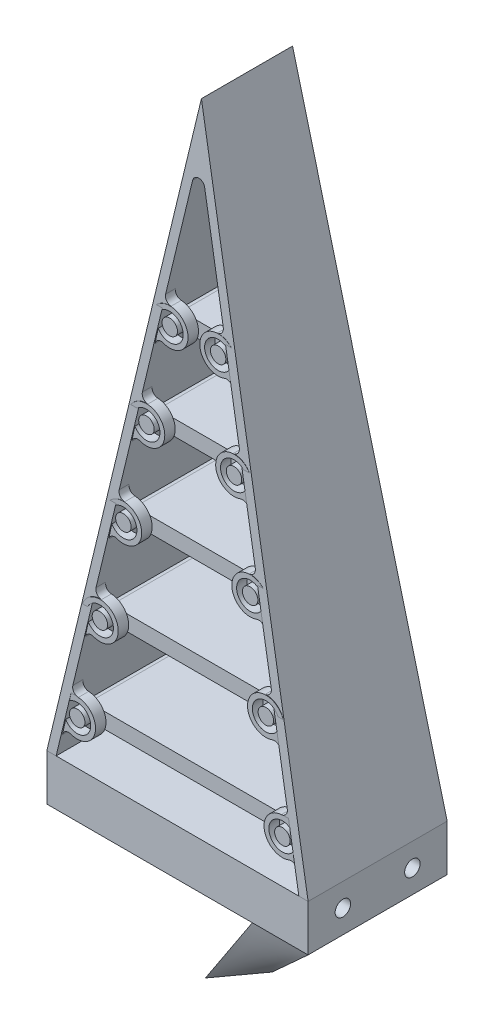
from build123d import *
from build123d.topology import SkipClean

# Parameters (mm, degrees)
AUFSATZ_LINEAR_AUSTRAGEN4_DEPTH      = 18
SCHNITT_LINEAR_AUSTRAGEN1_DEPTH      = 89.73537072
AUFSATZ_LINEAR_AUSTRAGEN5_DEPTH      = 5.37
AUFSATZ_LINEAR_AUSTRAGEN5_DEPTH_BACK = 5.37
AUFSATZ_LINEAR_AUSTRAGEN6_DEPTH      = 5.85
AUFSATZ_LINEAR_AUSTRAGEN6_DEPTH_BACK = 5.85
AUFSATZ_LINEAR_AUSTRAGEN7_DEPTH      = 6.3
AUFSATZ_LINEAR_AUSTRAGEN7_DEPTH_BACK = 6.3
AUFSATZ_LINEAR_AUSTRAGEN8_DEPTH      = 6.8
AUFSATZ_LINEAR_AUSTRAGEN8_DEPTH_BACK = 6.8
AUFSATZ_LINEAR_AUSTRAGEN9_DEPTH      = 7.2
AUFSATZ_LINEAR_AUSTRAGEN9_DEPTH_BACK = 7.2
SKIZZE13_R                           = 1
AUFSATZ_LINEAR_AUSTRAGEN12_DEPTH     = 1.5
SKIZZE15_R                           = 1
AUFSATZ_LINEAR_AUSTRAGEN14_DEPTH     = 1.5
SKIZZE14_R                           = 1
AUFSATZ_LINEAR_AUSTRAGEN13_DEPTH     = 1.5
SKIZZE16_R                           = 1
AUFSATZ_LINEAR_AUSTRAGEN15_DEPTH     = 1.5
SKIZZE17_R                           = 1
AUFSATZ_LINEAR_AUSTRAGEN16_DEPTH     = 1.5
SKIZZE18_R                           = 1
AUFSATZ_LINEAR_AUSTRAGEN17_DEPTH     = 1.5
SKIZZE19_R                           = 1
AUFSATZ_LINEAR_AUSTRAGEN18_DEPTH     = 1.5
SKIZZE20_R                           = 1
AUFSATZ_LINEAR_AUSTRAGEN19_DEPTH     = 1.5
SKIZZE21_R                           = 1
AUFSATZ_LINEAR_AUSTRAGEN20_DEPTH     = 1.5
SKIZZE22_R                           = 1
AUFSATZ_LINEAR_AUSTRAGEN21_DEPTH     = 1.5
SKIZZE24_R                           = 2.375
SKIZZE24_R_2                         = 1.75
AUFSATZ_LINEAR_AUSTRAGEN22_DEPTH     = 1.35
SKIZZE25_R                           = 2.375
SKIZZE25_R_2                         = 1.75
AUFSATZ_LINEAR_AUSTRAGEN23_DEPTH     = 1.35
SKIZZE26_R                           = 2.375
SKIZZE26_R_2                         = 1.75
AUFSATZ_LINEAR_AUSTRAGEN24_DEPTH     = 1.35
SKIZZE27_R                           = 2.375
SKIZZE27_R_2                         = 1.75
AUFSATZ_LINEAR_AUSTRAGEN25_DEPTH     = 1.35
SKIZZE28_R                           = 2.375
SKIZZE28_R_2                         = 1.75
AUFSATZ_LINEAR_AUSTRAGEN26_DEPTH     = 1.35
AUFSATZ_LINEAR_START                 = -1.35
SKIZZE29_R                           = 2.375
SKIZZE29_R_2                         = 1.75
AUFSATZ_LINEAR_AUSTRAGEN27_DEPTH     = 1.35
SKIZZE30_R                           = 2.375
SKIZZE30_R_2                         = 1.75
AUFSATZ_LINEAR_AUSTRAGEN28_DEPTH     = 1.35
SKIZZE31_R                           = 2.375
SKIZZE31_R_2                         = 1.75
AUFSATZ_LINEAR_AUSTRAGEN29_DEPTH     = 1.35
SKIZZE32_R                           = 2.375
SKIZZE32_R_2                         = 1.75
AUFSATZ_LINEAR_AUSTRAGEN30_DEPTH     = 1.35
SKIZZE33_R                           = 2.375
SKIZZE33_R_2                         = 1.75
AUFSATZ_LINEAR_AUSTRAGEN31_DEPTH     = 1.35
VERRUNDUNG1_R                        = 0.8
VERRUNDUNG2_R                        = 0.8
AUFSATZ_LINEAR_AUSTRAGEN32_DEPTH     = 6
SKIZZE78_R                           = 0.5
SCHNITT_LINEAR_AUSTRAGEN6_DEPTH      = 6
SKIZZE83_R                           = 1
SCHNITT_LINEAR_AUSTRAGEN7_DEPTH      = 4
SKIZZE84_R                           = 2
SCHNITT_LINEAR_AUSTRAGEN8_DEPTH      = 32
SKIZZE86_R                           = 1
SCHNITT_LINEAR_AUSTRAGEN9_DEPTH      = 4


with BuildPart() as part:
    # Skizze1 → Aufsatz-Linear austragen4 (new body)
    with BuildSketch(Plane.XY):
        Polygon((0, 0), (16.911148858, -80), (15.711148858, -80), (0, -5.676728459), (-15.711148858, -80), (-16.911148858, -80), align=None)
    extrude(amount=AUFSATZ_LINEAR_AUSTRAGEN4_DEPTH)

    # Skizze11 → Schnitt-Linear austragen1 (cut, through all)
    with BuildSketch(Plane(origin=(17, 0, 0), x_dir=(0, 0, -1), z_dir=(1, 0, 0))):
        Polygon((-18, -80), (-14.9, 0), (-18, 0), align=None)
        Polygon((0, -80), (-3.1, 0), (0, 0), align=None)
    extrude(amount=-SCHNITT_LINEAR_AUSTRAGEN1_DEPTH, mode=Mode.SUBTRACT)

    # Skizze24 → Aufsatz-Linear austragen22 (add)
    # profile 1 of 2: a face of its own
    with BuildSketch(Plane.XY.offset(15.87)):
        with Locations((-3.132547008, -26.676728459)):
            Circle(SKIZZE24_R)
        with Locations((-3.132547008, -26.676728459)):
            Circle(SKIZZE24_R_2, mode=Mode.SUBTRACT)
    # profile 2 of 2: a face of its own
    with BuildSketch(Plane.XY.offset(15.87)):
        with Locations((3.132547008, -26.676728459)):
            Circle(SKIZZE24_R)
        with Locations((3.132547008, -26.676728459)):
            Circle(SKIZZE24_R_2, mode=Mode.SUBTRACT)
    extrude(amount=-AUFSATZ_LINEAR_AUSTRAGEN22_DEPTH)

    # Skizze25 → Aufsatz-Linear austragen23 (add)
    # profile 1 of 2: a face of its own
    with BuildSketch(Plane.XY.offset(16.35)):
        with Locations((-5.669219336, -38.676728459)):
            Circle(SKIZZE25_R)
        with Locations((-5.669219336, -38.676728459)):
            Circle(SKIZZE25_R_2, mode=Mode.SUBTRACT)
    # profile 2 of 2: a face of its own
    with BuildSketch(Plane.XY.offset(16.35)):
        with Locations((5.669219336, -38.676728459)):
            Circle(SKIZZE25_R)
        with Locations((5.669219336, -38.676728459)):
            Circle(SKIZZE25_R_2, mode=Mode.SUBTRACT)
    extrude(amount=-AUFSATZ_LINEAR_AUSTRAGEN23_DEPTH)

    # Skizze26 → Aufsatz-Linear austragen24 (add)
    # profile 1 of 2: a face of its own
    with BuildSketch(Plane.XY.offset(16.8)):
        with Locations((-8.205891665, -50.676728459)):
            Circle(SKIZZE26_R)
        with Locations((-8.205891665, -50.676728459)):
            Circle(SKIZZE26_R_2, mode=Mode.SUBTRACT)
    # profile 2 of 2: a face of its own
    with BuildSketch(Plane.XY.offset(16.8)):
        with Locations((8.205891665, -50.676728459)):
            Circle(SKIZZE26_R)
        with Locations((8.205891665, -50.676728459)):
            Circle(SKIZZE26_R_2, mode=Mode.SUBTRACT)
    extrude(amount=-AUFSATZ_LINEAR_AUSTRAGEN24_DEPTH)

    # Skizze27 → Aufsatz-Linear austragen25 (add)
    # profile 1 of 2: a face of its own
    with BuildSketch(Plane.XY.offset(17.3)):
        with Locations((-10.742563994, -62.676728459)):
            Circle(SKIZZE27_R)
        with Locations((-10.742563994, -62.676728459)):
            Circle(SKIZZE27_R_2, mode=Mode.SUBTRACT)
    # profile 2 of 2: a face of its own
    with BuildSketch(Plane.XY.offset(17.3)):
        with Locations((10.742563994, -62.676728459)):
            Circle(SKIZZE27_R)
        with Locations((10.742563994, -62.676728459)):
            Circle(SKIZZE27_R_2, mode=Mode.SUBTRACT)
    extrude(amount=-AUFSATZ_LINEAR_AUSTRAGEN25_DEPTH)

    # Skizze28 → Aufsatz-Linear austragen26 (add)
    # profile 1 of 2: a face of its own
    with BuildSketch(Plane.XY.offset(17.7)):
        with Locations((-13.279236322, -74.676728459)):
            Circle(SKIZZE28_R)
        with Locations((-13.279236322, -74.676728459)):
            Circle(SKIZZE28_R_2, mode=Mode.SUBTRACT)
    # profile 2 of 2: a face of its own
    with BuildSketch(Plane.XY.offset(17.7)):
        with Locations((13.279236322, -74.676728459)):
            Circle(SKIZZE28_R)
        with Locations((13.279236322, -74.676728459)):
            Circle(SKIZZE28_R_2, mode=Mode.SUBTRACT)
    extrude(amount=-AUFSATZ_LINEAR_AUSTRAGEN26_DEPTH)

    # Skizze29 → Aufsatz-Linear austragen27 (add)
    # profile 1 of 2: a face of its own
    with BuildSketch(Plane(origin=(0, 0, 2.13), x_dir=(-1, 0, 0), z_dir=(0, 0, -1)).offset(AUFSATZ_LINEAR_START)):
        with Locations((-3.132547008, -26.676728459)):
            Circle(SKIZZE29_R)
        with Locations((-3.132547008, -26.676728459)):
            Circle(SKIZZE29_R_2, mode=Mode.SUBTRACT)
    # profile 2 of 2: a face of its own
    with BuildSketch(Plane(origin=(0, 0, 2.13), x_dir=(-1, 0, 0), z_dir=(0, 0, -1)).offset(AUFSATZ_LINEAR_START)):
        with Locations((3.132547008, -26.676728459)):
            Circle(SKIZZE29_R)
        with Locations((3.132547008, -26.676728459)):
            Circle(SKIZZE29_R_2, mode=Mode.SUBTRACT)
    extrude(amount=AUFSATZ_LINEAR_AUSTRAGEN27_DEPTH)

    # Skizze30 → Aufsatz-Linear austragen28 (add)
    # profile 1 of 2: a face of its own
    with BuildSketch(Plane(origin=(0, 0, 1.65), x_dir=(-1, 0, 0), z_dir=(0, 0, -1)).offset(AUFSATZ_LINEAR_START)):
        with Locations((-5.669219336, -38.676728459)):
            Circle(SKIZZE30_R)
        with Locations((-5.669219336, -38.676728459)):
            Circle(SKIZZE30_R_2, mode=Mode.SUBTRACT)
    # profile 2 of 2: a face of its own
    with BuildSketch(Plane(origin=(0, 0, 1.65), x_dir=(-1, 0, 0), z_dir=(0, 0, -1)).offset(AUFSATZ_LINEAR_START)):
        with Locations((5.669219336, -38.676728459)):
            Circle(SKIZZE30_R)
        with Locations((5.669219336, -38.676728459)):
            Circle(SKIZZE30_R_2, mode=Mode.SUBTRACT)
    extrude(amount=AUFSATZ_LINEAR_AUSTRAGEN28_DEPTH)

    # Skizze31 → Aufsatz-Linear austragen29 (add)
    # profile 1 of 2: a face of its own
    with BuildSketch(Plane(origin=(0, 0, 1.2), x_dir=(-1, 0, 0), z_dir=(0, 0, -1)).offset(AUFSATZ_LINEAR_START)):
        with Locations((-8.205891665, -50.676728459)):
            Circle(SKIZZE31_R)
        with Locations((-8.205891665, -50.676728459)):
            Circle(SKIZZE31_R_2, mode=Mode.SUBTRACT)
    # profile 2 of 2: a face of its own
    with BuildSketch(Plane(origin=(0, 0, 1.2), x_dir=(-1, 0, 0), z_dir=(0, 0, -1)).offset(AUFSATZ_LINEAR_START)):
        with Locations((8.205891665, -50.676728459)):
            Circle(SKIZZE31_R)
        with Locations((8.205891665, -50.676728459)):
            Circle(SKIZZE31_R_2, mode=Mode.SUBTRACT)
    extrude(amount=AUFSATZ_LINEAR_AUSTRAGEN29_DEPTH)

    # Skizze32 → Aufsatz-Linear austragen30 (add)
    # profile 1 of 2: a face of its own
    with BuildSketch(Plane(origin=(0, 0, 0.7), x_dir=(-1, 0, 0), z_dir=(0, 0, -1)).offset(AUFSATZ_LINEAR_START)):
        with Locations((-10.742563994, -62.676728459)):
            Circle(SKIZZE32_R)
        with Locations((-10.742563994, -62.676728459)):
            Circle(SKIZZE32_R_2, mode=Mode.SUBTRACT)
    # profile 2 of 2: a face of its own
    with BuildSketch(Plane(origin=(0, 0, 0.7), x_dir=(-1, 0, 0), z_dir=(0, 0, -1)).offset(AUFSATZ_LINEAR_START)):
        with Locations((10.742563994, -62.676728459)):
            Circle(SKIZZE32_R)
        with Locations((10.742563994, -62.676728459)):
            Circle(SKIZZE32_R_2, mode=Mode.SUBTRACT)
    extrude(amount=AUFSATZ_LINEAR_AUSTRAGEN30_DEPTH)

    # Skizze33 → Aufsatz-Linear austragen31 (add)
    # profile 1 of 2: a face of its own
    with BuildSketch(Plane(origin=(0, 0, 0.3), x_dir=(-1, 0, 0), z_dir=(0, 0, -1)).offset(AUFSATZ_LINEAR_START)):
        with Locations((-13.279236322, -74.676728459)):
            Circle(SKIZZE33_R)
        with Locations((-13.279236322, -74.676728459)):
            Circle(SKIZZE33_R_2, mode=Mode.SUBTRACT)
    # profile 2 of 2: a face of its own
    with BuildSketch(Plane(origin=(0, 0, 0.3), x_dir=(-1, 0, 0), z_dir=(0, 0, -1)).offset(AUFSATZ_LINEAR_START)):
        with Locations((13.279236322, -74.676728459)):
            Circle(SKIZZE33_R)
        with Locations((13.279236322, -74.676728459)):
            Circle(SKIZZE33_R_2, mode=Mode.SUBTRACT)
    extrude(amount=AUFSATZ_LINEAR_AUSTRAGEN31_DEPTH)

    # Verrundung1
    verrundung1_edges = [part.edges().sort_by_distance(p)[0] for p in [
        (0, -5.676728459, 9),
    ]]
    fillet(verrundung1_edges, radius=VERRUNDUNG1_R)

    # Verrundung2
    # the kernel refuses this fillet: 0.8 mm, written as the material it adds along each edge
    with BuildSketch(Plane(origin=(7.333926251, -40.370651683, 15), x_dir=(0.20681895998091462, -0.9783792300495819, 0), z_dir=(0, 0, 1)), Plane(origin=(9.87059858, -52.370651683, 15.45), x_dir=(0.20681895998091263, -0.9783792300495825, 0), z_dir=(0, 0, 1)), Plane(origin=(12.407270908, -64.370651683, 15.95), x_dir=(0.20681895998091412, -0.9783792300495822, 0), z_dir=(0, 0, 1)), Plane(origin=(14.943943237, -76.370651683, 16.35), x_dir=(0.20681895998090907, -0.9783792300495833, 0), z_dir=(0, 0, 1)), Plane(origin=(4.797253922, -28.370651683, 2.13), x_dir=(0.20681895998091462, -0.9783792300495819, 0), z_dir=(0, 0, 1)), Plane(origin=(7.333926251, -40.370651683, 1.65), x_dir=(0.20681895998091462, -0.9783792300495819, 0), z_dir=(0, 0, 1)), Plane(origin=(9.87059858, -52.370651683, 1.2), x_dir=(0.20681895998091412, -0.9783792300495822, 0), z_dir=(0, 0, 1)), Plane(origin=(12.407270908, -64.370651683, 0.7), x_dir=(0.20681895998091412, -0.9783792300495822, 0), z_dir=(0, 0, 1)), Plane(origin=(14.943943237, -76.370651683, 0.3), x_dir=(0.20681895998091113, -0.9783792300495827, 0), z_dir=(0, 0, 1)), Plane(origin=(4.797253922, -28.370651683, 14.52), x_dir=(0.20681895998091462, -0.9783792300495819, 0), z_dir=(0, 0, 1))) as verrundung2_piece_1:
        with BuildLine():
            CenterArc((1.137162009, -0.8), VERRUNDUNG2_R, 90, 98.665792169)
            ThreePointArc((0.346294794, -0.920536499), (0.221320117, -0.44214625), (0, 0))
            Line((0, 0), (1.137162009, 0))
        make_face()
    extrude(amount=1.35)
    with BuildSketch(Plane(origin=(6.505991795, -36.45401911, 15), x_dir=(-0.20681895998091487, 0.9783792300495819, 0), z_dir=(0, 0, 1))) as verrundung2_piece_2_section:
        with BuildLine():
            CenterArc((1.137162009, 0.8), VERRUNDUNG2_R, 171.334207831, 98.665792169)
            ThreePointArc((0.346294794, 0.920536499), (0.221320117, 0.44214625), (0, 0))
            Line((0, 0), (1.137162009, 0))
        make_face()
    verrundung2_piece_2 = extrude(amount=4.155498263, mode=Mode.PRIVATE)
    verrundung2_piece_2 = split(verrundung2_piece_2, bisect_by=Plane(origin=(6.217215771, -36.095589606, 16.298704097), z_dir=(0, -0.03872093994908253, -0.9992500632021294)), keep=Keep.TOP, mode=Mode.PRIVATE)
    add(verrundung2_piece_2)
    with BuildSketch(Plane(origin=(-9.87059858, -52.370651683, 15.45), x_dir=(-0.20681895998091412, -0.9783792300495822, 0), z_dir=(0, 0, 1)), Plane(origin=(-12.407270908, -64.370651683, 15.95), x_dir=(-0.2068189599809156, -0.9783792300495817, 0), z_dir=(0, 0, 1)), Plane(origin=(-14.943943237, -76.370651683, 16.35), x_dir=(-0.2068189599809131, -0.9783792300495824, 0), z_dir=(0, 0, 1)), Plane(origin=(-4.797253922, -28.370651683, 2.13), x_dir=(-0.20681895998091113, -0.9783792300495827, 0), z_dir=(0, 0, 1)), Plane(origin=(-7.333926251, -40.370651683, 1.65), x_dir=(-0.2068189599809139, -0.9783792300495822, 0), z_dir=(0, 0, 1)), Plane(origin=(-9.87059858, -52.370651683, 1.2), x_dir=(-0.20681895998091412, -0.9783792300495822, 0), z_dir=(0, 0, 1)), Plane(origin=(-12.407270908, -64.370651683, 0.7), x_dir=(-0.20681895998091412, -0.9783792300495822, 0), z_dir=(0, 0, 1)), Plane(origin=(-14.943943237, -76.370651683, 0.3), x_dir=(-0.2068189599809131, -0.9783792300495824, 0), z_dir=(0, 0, 1)), Plane(origin=(-4.797253922, -28.370651683, 14.52), x_dir=(-0.20681895998091177, -0.9783792300495826, 0), z_dir=(0, 0, 1)), Plane(origin=(-7.333926251, -40.370651683, 15), x_dir=(-0.20681895998091412, -0.9783792300495822, 0), z_dir=(0, 0, 1))) as verrundung2_piece_3:
        with BuildLine():
            CenterArc((1.137162009, 0.8), VERRUNDUNG2_R, 171.334207831, 98.665792169)
            ThreePointArc((0.346294794, 0.920536499), (0.221320117, 0.44214625), (0, 0))
            Line((0, 0), (1.137162009, 0))
        make_face()
    extrude(amount=1.35)
    with BuildSketch(Plane(origin=(-9.042664124, -48.45401911, 15.45), x_dir=(0.20681895998091288, 0.9783792300495825, 0), z_dir=(0, 0, 1))) as verrundung2_piece_4_section:
        with BuildLine():
            CenterArc((1.137162009, -0.8), VERRUNDUNG2_R, 90, 98.665792169)
            ThreePointArc((0.346294794, -0.920536499), (0.221320117, -0.44214625), (0, 0))
            Line((0, 0), (1.137162009, 0))
        make_face()
    verrundung2_piece_4 = extrude(amount=4.170498263, mode=Mode.PRIVATE)
    verrundung2_piece_4 = split(verrundung2_piece_4, bisect_by=Plane(origin=(-8.753891259, -48.095283689, 16.763692243), z_dir=(0, -0.03872093994908253, -0.9992500632021294)), keep=Keep.TOP, mode=Mode.PRIVATE)
    add(verrundung2_piece_4)
    with BuildSketch(Plane(origin=(9.042664124, -48.45401911, 15.45), x_dir=(-0.2068189599809156, 0.9783792300495817, 0), z_dir=(0, 0, 1))) as verrundung2_piece_5_section:
        with BuildLine():
            CenterArc((1.137162009, 0.8), VERRUNDUNG2_R, 171.334207831, 98.665792169)
            ThreePointArc((0.346294794, 0.920536499), (0.221320117, 0.44214625), (0, 0))
            Line((0, 0), (1.137162009, 0))
        make_face()
    verrundung2_piece_5 = extrude(amount=4.170498263, mode=Mode.PRIVATE)
    verrundung2_piece_5 = split(verrundung2_piece_5, bisect_by=Plane(origin=(8.753891259, -48.095283689, 16.763692243), z_dir=(0, -0.03872093994908253, -0.9992500632021294)), keep=Keep.TOP, mode=Mode.PRIVATE)
    add(verrundung2_piece_5)
    with BuildSketch(Plane(origin=(-11.579336453, -60.45401911, 15.95), x_dir=(0.2068189599809101, 0.9783792300495829, 0), z_dir=(0, 0, 1))) as verrundung2_piece_6_section:
        with BuildLine():
            CenterArc((1.137162009, -0.8), VERRUNDUNG2_R, 90, 98.665792169)
            ThreePointArc((0.346294794, -0.920536499), (0.221320117, -0.44214625), (0, 0))
            Line((0, 0), (1.137162009, 0))
        make_face()
    verrundung2_piece_6 = extrude(amount=4.135498263, mode=Mode.PRIVATE)
    verrundung2_piece_6 = split(verrundung2_piece_6, bisect_by=Plane(origin=(-11.290556099, -60.095998069, 17.228719925), z_dir=(0, -0.03872093994908253, -0.9992500632021294)), keep=Keep.TOP, mode=Mode.PRIVATE)
    add(verrundung2_piece_6)
    with BuildSketch(Plane(origin=(11.579336453, -60.45401911, 15.95), x_dir=(-0.20681895998091435, 0.978379230049582, 0), z_dir=(0, 0, 1))) as verrundung2_piece_7_section:
        with BuildLine():
            CenterArc((1.137162009, 0.8), VERRUNDUNG2_R, 171.334207831, 98.665792169)
            ThreePointArc((0.346294794, 0.920536499), (0.221320117, 0.44214625), (0, 0))
            Line((0, 0), (1.137162009, 0))
        make_face()
    verrundung2_piece_7 = extrude(amount=4.135498263, mode=Mode.PRIVATE)
    verrundung2_piece_7 = split(verrundung2_piece_7, bisect_by=Plane(origin=(11.290556099, -60.095998069, 17.228719925), z_dir=(0, -0.03872093994908253, -0.9992500632021294)), keep=Keep.TOP, mode=Mode.PRIVATE)
    add(verrundung2_piece_7)
    with BuildSketch(Plane(origin=(-14.116008781, -72.45401911, 16.35), x_dir=(0.20681895998091412, 0.9783792300495822, 0), z_dir=(0, 0, 1))) as verrundung2_piece_8_section:
        with BuildLine():
            CenterArc((1.137162009, -0.8), VERRUNDUNG2_R, 90, 98.665792169)
            ThreePointArc((0.346294794, -0.920536499), (0.221320117, -0.44214625), (0, 0))
            Line((0, 0), (1.137162009, 0))
        make_face()
    verrundung2_piece_8 = extrude(amount=1.35, mode=Mode.PRIVATE)
    verrundung2_piece_8 = split(verrundung2_piece_8, bisect_by=Plane(origin=(-13.827218085, -72.094512866, 17.693662374), z_dir=(0, -0.03872093994908253, -0.9992500632021294)), keep=Keep.TOP, mode=Mode.PRIVATE)
    add(verrundung2_piece_8)
    with BuildSketch(Plane(origin=(14.116008781, -72.45401911, 16.35), x_dir=(-0.20681895998091662, 0.9783792300495815, 0), z_dir=(0, 0, 1))) as verrundung2_piece_9_section:
        with BuildLine():
            CenterArc((1.137162009, 0.8), VERRUNDUNG2_R, 171.334207831, 98.665792169)
            ThreePointArc((0.346294794, 0.920536499), (0.221320117, 0.44214625), (0, 0))
            Line((0, 0), (1.137162009, 0))
        make_face()
    verrundung2_piece_9 = extrude(amount=1.35, mode=Mode.PRIVATE)
    verrundung2_piece_9 = split(verrundung2_piece_9, bisect_by=Plane(origin=(13.827218085, -72.094512866, 17.693662374), z_dir=(0, -0.03872093994908253, -0.9992500632021294)), keep=Keep.TOP, mode=Mode.PRIVATE)
    add(verrundung2_piece_9)
    with BuildSketch(Plane(origin=(3.969319467, -24.45401911, -0.690498263), x_dir=(-0.20681895998091412, 0.9783792300495822, 0), z_dir=(0, 0, 1))) as verrundung2_piece_10_section:
        with BuildLine():
            CenterArc((1.137162009, 0.8), VERRUNDUNG2_R, 171.334207831, 98.665792169)
            ThreePointArc((0.346294794, 0.920536499), (0.221320117, 0.44214625), (0, 0))
            Line((0, 0), (1.137162009, 0))
        make_face()
    verrundung2_piece_10 = extrude(amount=4.170498263, mode=Mode.PRIVATE)
    verrundung2_piece_10 = split(verrundung2_piece_10, bisect_by=Plane(origin=(3.680546602, -24.095283689, 2.166307757), z_dir=(0, -0.03872093994908251, 0.9992500632021294)), keep=Keep.TOP, mode=Mode.PRIVATE)
    add(verrundung2_piece_10)
    with BuildSketch(Plane(origin=(-3.969319467, -24.45401911, -0.690498263), x_dir=(0.20681895998091285, 0.9783792300495823, 0), z_dir=(0, 0, 1))) as verrundung2_piece_11_section:
        with BuildLine():
            CenterArc((1.137162009, -0.8), VERRUNDUNG2_R, 90, 98.665792169)
            ThreePointArc((0.346294794, -0.920536499), (0.221320117, -0.44214625), (0, 0))
            Line((0, 0), (1.137162009, 0))
        make_face()
    verrundung2_piece_11 = extrude(amount=4.170498263, mode=Mode.PRIVATE)
    verrundung2_piece_11 = split(verrundung2_piece_11, bisect_by=Plane(origin=(-3.680546602, -24.095283689, 2.166307757), z_dir=(0, -0.03872093994908251, 0.9992500632021294)), keep=Keep.TOP, mode=Mode.PRIVATE)
    add(verrundung2_piece_11)
    with BuildSketch(Plane(origin=(6.505991795, -36.45401911, -1.155498263), x_dir=(-0.20681895998091537, 0.9783792300495818, 0), z_dir=(0, 0, 1))) as verrundung2_piece_12_section:
        with BuildLine():
            CenterArc((1.137162009, 0.8), VERRUNDUNG2_R, 171.334207831, 98.665792169)
            ThreePointArc((0.346294794, 0.920536499), (0.221320117, 0.44214625), (0, 0))
            Line((0, 0), (1.137162009, 0))
        make_face()
    verrundung2_piece_12 = extrude(amount=4.155498263, mode=Mode.PRIVATE)
    verrundung2_piece_12 = split(verrundung2_piece_12, bisect_by=Plane(origin=(6.217215771, -36.095589606, 1.701295903), z_dir=(0, -0.03872093994908251, 0.9992500632021294)), keep=Keep.TOP, mode=Mode.PRIVATE)
    add(verrundung2_piece_12)
    with BuildSketch(Plane(origin=(-6.505991795, -36.45401911, -1.155498263), x_dir=(0.20681895998091288, 0.9783792300495825, 0), z_dir=(0, 0, 1))) as verrundung2_piece_13_section:
        with BuildLine():
            CenterArc((1.137162009, -0.8), VERRUNDUNG2_R, 90, 98.665792169)
            ThreePointArc((0.346294794, -0.920536499), (0.221320117, -0.44214625), (0, 0))
            Line((0, 0), (1.137162009, 0))
        make_face()
    verrundung2_piece_13 = extrude(amount=4.155498263, mode=Mode.PRIVATE)
    verrundung2_piece_13 = split(verrundung2_piece_13, bisect_by=Plane(origin=(-6.217215771, -36.095589606, 1.701295903), z_dir=(0, -0.03872093994908251, 0.9992500632021294)), keep=Keep.TOP, mode=Mode.PRIVATE)
    add(verrundung2_piece_13)
    with BuildSketch(Plane(origin=(9.042664124, -48.45401911, -1.620498263), x_dir=(-0.20681895998091412, 0.9783792300495822, 0), z_dir=(0, 0, 1))) as verrundung2_piece_14_section:
        with BuildLine():
            CenterArc((1.137162009, 0.8), VERRUNDUNG2_R, 171.334207831, 98.665792169)
            ThreePointArc((0.346294794, 0.920536499), (0.221320117, 0.44214625), (0, 0))
            Line((0, 0), (1.137162009, 0))
        make_face()
    verrundung2_piece_14 = extrude(amount=4.170498263, mode=Mode.PRIVATE)
    verrundung2_piece_14 = split(verrundung2_piece_14, bisect_by=Plane(origin=(8.753891259, -48.095283689, 1.236307757), z_dir=(0, -0.03872093994908251, 0.9992500632021294)), keep=Keep.TOP, mode=Mode.PRIVATE)
    add(verrundung2_piece_14)
    with BuildSketch(Plane(origin=(-9.042664124, -48.45401911, -1.620498263), x_dir=(0.20681895998091263, 0.9783792300495825, 0), z_dir=(0, 0, 1))) as verrundung2_piece_15_section:
        with BuildLine():
            CenterArc((1.137162009, -0.8), VERRUNDUNG2_R, 90, 98.665792169)
            ThreePointArc((0.346294794, -0.920536499), (0.221320117, -0.44214625), (0, 0))
            Line((0, 0), (1.137162009, 0))
        make_face()
    verrundung2_piece_15 = extrude(amount=4.170498263, mode=Mode.PRIVATE)
    verrundung2_piece_15 = split(verrundung2_piece_15, bisect_by=Plane(origin=(-8.753891259, -48.095283689, 1.236307757), z_dir=(0, -0.03872093994908251, 0.9992500632021294)), keep=Keep.TOP, mode=Mode.PRIVATE)
    add(verrundung2_piece_15)
    with BuildSketch(Plane(origin=(11.579336453, -60.45401911, -2.085498263), x_dir=(-0.20681895998091412, 0.9783792300495822, 0), z_dir=(0, 0, 1))) as verrundung2_piece_16_section:
        with BuildLine():
            CenterArc((1.137162009, 0.8), VERRUNDUNG2_R, 171.334207831, 98.665792169)
            ThreePointArc((0.346294794, 0.920536499), (0.221320117, 0.44214625), (0, 0))
            Line((0, 0), (1.137162009, 0))
        make_face()
    verrundung2_piece_16 = extrude(amount=4.135498263, mode=Mode.PRIVATE)
    verrundung2_piece_16 = split(verrundung2_piece_16, bisect_by=Plane(origin=(11.290556099, -60.095998069, 0.771280075), z_dir=(0, -0.03872093994908251, 0.9992500632021294)), keep=Keep.TOP, mode=Mode.PRIVATE)
    add(verrundung2_piece_16)
    with BuildSketch(Plane(origin=(-11.579336453, -60.45401911, -2.085498263), x_dir=(0.2068189599809131, 0.9783792300495824, 0), z_dir=(0, 0, 1))) as verrundung2_piece_17_section:
        with BuildLine():
            CenterArc((1.137162009, -0.8), VERRUNDUNG2_R, 90, 98.665792169)
            ThreePointArc((0.346294794, -0.920536499), (0.221320117, -0.44214625), (0, 0))
            Line((0, 0), (1.137162009, 0))
        make_face()
    verrundung2_piece_17 = extrude(amount=4.135498263, mode=Mode.PRIVATE)
    verrundung2_piece_17 = split(verrundung2_piece_17, bisect_by=Plane(origin=(-11.290556099, -60.095998069, 0.771280075), z_dir=(0, -0.03872093994908251, 0.9992500632021294)), keep=Keep.TOP, mode=Mode.PRIVATE)
    add(verrundung2_piece_17)
    with BuildSketch(Plane(origin=(14.116008781, -72.45401911, 0.3), x_dir=(-0.2068189599809156, 0.9783792300495817, 0), z_dir=(0, 0, 1))) as verrundung2_piece_18_section:
        with BuildLine():
            CenterArc((1.137162009, 0.8), VERRUNDUNG2_R, 171.334207831, 98.665792169)
            ThreePointArc((0.346294794, 0.920536499), (0.221320117, 0.44214625), (0, 0))
            Line((0, 0), (1.137162009, 0))
        make_face()
    verrundung2_piece_18 = extrude(amount=1.35, mode=Mode.PRIVATE)
    verrundung2_piece_18 = split(verrundung2_piece_18, bisect_by=Plane(origin=(13.827218085, -72.094512866, 0.306337626), z_dir=(0, -0.03872093994908251, 0.9992500632021294)), keep=Keep.TOP, mode=Mode.PRIVATE)
    add(verrundung2_piece_18)
    with BuildSketch(Plane(origin=(-14.116008781, -72.45401911, 0.3), x_dir=(0.20681895998091412, 0.9783792300495822, 0), z_dir=(0, 0, 1))) as verrundung2_piece_19_section:
        with BuildLine():
            CenterArc((1.137162009, -0.8), VERRUNDUNG2_R, 90, 98.665792169)
            ThreePointArc((0.346294794, -0.920536499), (0.221320117, -0.44214625), (0, 0))
            Line((0, 0), (1.137162009, 0))
        make_face()
    verrundung2_piece_19 = extrude(amount=1.35, mode=Mode.PRIVATE)
    verrundung2_piece_19 = split(verrundung2_piece_19, bisect_by=Plane(origin=(-13.827218085, -72.094512866, 0.306337626), z_dir=(0, -0.03872093994908251, 0.9992500632021294)), keep=Keep.TOP, mode=Mode.PRIVATE)
    add(verrundung2_piece_19)
    with BuildSketch(Plane(origin=(-3.969319467, -24.45401911, 14.52), x_dir=(0.20681895998091399, 0.978379230049582, 0), z_dir=(0, 0, 1))) as verrundung2_piece_20_section:
        with BuildLine():
            CenterArc((1.137162009, -0.8), VERRUNDUNG2_R, 90, 98.665792169)
            ThreePointArc((0.346294794, -0.920536499), (0.221320117, -0.44214625), (0, 0))
            Line((0, 0), (1.137162009, 0))
        make_face()
    verrundung2_piece_20 = extrude(amount=4.170498263, mode=Mode.PRIVATE)
    verrundung2_piece_20 = split(verrundung2_piece_20, bisect_by=Plane(origin=(-3.680546602, -24.095283689, 15.833692243), z_dir=(0, -0.03872093994908253, -0.9992500632021294)), keep=Keep.TOP, mode=Mode.PRIVATE)
    add(verrundung2_piece_20)
    with BuildSketch(Plane(origin=(3.969319467, -24.45401911, 14.52), x_dir=(-0.20681895998091487, 0.9783792300495819, 0), z_dir=(0, 0, 1))) as verrundung2_piece_21_section:
        with BuildLine():
            CenterArc((1.137162009, 0.8), VERRUNDUNG2_R, 171.334207831, 98.665792169)
            ThreePointArc((0.346294794, 0.920536499), (0.221320117, 0.44214625), (0, 0))
            Line((0, 0), (1.137162009, 0))
        make_face()
    verrundung2_piece_21 = extrude(amount=4.170498263, mode=Mode.PRIVATE)
    verrundung2_piece_21 = split(verrundung2_piece_21, bisect_by=Plane(origin=(3.680546602, -24.095283689, 15.833692243), z_dir=(0, -0.03872093994908253, -0.9992500632021294)), keep=Keep.TOP, mode=Mode.PRIVATE)
    add(verrundung2_piece_21)
    with BuildSketch(Plane(origin=(-6.505991795, -36.45401911, 15), x_dir=(0.20681895998091263, 0.9783792300495825, 0), z_dir=(0, 0, 1))) as verrundung2_piece_22_section:
        with BuildLine():
            CenterArc((1.137162009, -0.8), VERRUNDUNG2_R, 90, 98.665792169)
            ThreePointArc((0.346294794, -0.920536499), (0.221320117, -0.44214625), (0, 0))
            Line((0, 0), (1.137162009, 0))
        make_face()
    verrundung2_piece_22 = extrude(amount=4.155498263, mode=Mode.PRIVATE)
    verrundung2_piece_22 = split(verrundung2_piece_22, bisect_by=Plane(origin=(-6.217215771, -36.095589606, 16.298704097), z_dir=(0, -0.03872093994908253, -0.9992500632021294)), keep=Keep.TOP, mode=Mode.PRIVATE)
    add(verrundung2_piece_22)

    # Skizze37 → Aufsatz-Linear austragen32 (add)
    with BuildSketch(Plane.XZ.offset(80)):
        Polygon((-16.911148858, 0), (-15.711148858, 0), (16.911148858, 0), (16.911148858, 18), (-16.911148858, 18), align=None)
    extrude(amount=AUFSATZ_LINEAR_AUSTRAGEN32_DEPTH)

    # Skizze68 → Ausformung1 section 0
    with BuildSketch(Plane.XZ.offset(86)):
        with BuildLine():
            Line((16.911148858, 0), (16.911148858, 18))
            Line((16.911148858, 18), (9.693720963, 18))
            Line((9.693720963, 18), (9.693720963, 0))
            Line((9.693720963, 0), (16.911148858, 0))
        make_face()
    # Skizze80 → Ausformung1 section 1
    with BuildSketch(Plane(origin=(42.871879577, -74.256273644, 0), x_dir=(0, 0, -1), z_dir=(0.500000000000001, -0.866025403784438, 0))):
        with BuildLine():
            Line((-3.999971038, -49.932917644), (-3.999971038, -39.951059688))
            Line((-3.999971038, -39.951059688), (-14.009034932, -39.951059688))
            Line((-14.009034932, -39.951059688), (-14.009034932, -49.932917644))
            Line((-14.009034932, -49.932917644), (-3.999971038, -49.932917644))
        make_face()
    loft()

    # Skizze78 → Schnitt-Linear austragen6 (cut)
    with BuildSketch(Plane.XZ.offset(86)):
        with Locations(Location((-13.614380811, 9, 0), (0, 0, 270))):
            Circle(SKIZZE78_R)
    extrude(amount=-SCHNITT_LINEAR_AUSTRAGEN6_DEPTH, mode=Mode.SUBTRACT)

    # Skizze83 → Schnitt-Linear austragen7 (cut)
    with BuildSketch(Plane(origin=(42.871879577, -74.256273644, 0), x_dir=(0.8660254037844386, 0.5000000000000002, 0), z_dir=(0.5000000000000001, -0.8660254037844385, 0))):
        with Locations((-44.941988666, 9.004502985)):
            Circle(SKIZZE83_R)
    extrude(amount=-SCHNITT_LINEAR_AUSTRAGEN7_DEPTH, mode=Mode.SUBTRACT)

    # Skizze84 → Schnitt-Linear austragen8 (cut)
    with BuildSketch(Plane.ZY.offset(16.911148858)):
        with Locations((13.5, -83)):
            Circle(SKIZZE84_R)
        with Locations((4.5, -83)):
            Circle(SKIZZE84_R)
    extrude(amount=-SCHNITT_LINEAR_AUSTRAGEN8_DEPTH, mode=Mode.SUBTRACT)

    # Skizze86 → Schnitt-Linear austragen9 (cut)
    with BuildSketch(Plane(origin=(16.911148858, 0, 0), x_dir=(0, 0, -1), z_dir=(1, 0, 0))):
        with Locations((-13.5, -83)):
            Circle(SKIZZE86_R)
        with Locations((-4.5, -83)):
            Circle(SKIZZE86_R)
    extrude(amount=-SCHNITT_LINEAR_AUSTRAGEN9_DEPTH, mode=Mode.SUBTRACT)


with BuildPart() as body_2:
    # Skizze6 → Aufsatz-Linear austragen5 (new, two sides: drawn at the far end of the back side and taken through both)
    with BuildSketch(Plane.XY.offset(9).offset(-AUFSATZ_LINEAR_AUSTRAGEN5_DEPTH_BACK)):
        with BuildLine():
            Line((3.132547008, -25.676728459), (-3.132547008, -25.676728459))
            ThreePointArc((-3.132547008, -25.676728459), (-4.132547008, -26.676728459), (-3.132547008, -27.676728459))
            Line((-3.132547008, -27.676728459), (3.132547008, -27.676728459))
            ThreePointArc((3.132547008, -27.676728459), (4.132547008, -26.676728459), (3.132547008, -25.676728459))
        make_face()
    extrude(amount=AUFSATZ_LINEAR_AUSTRAGEN5_DEPTH + AUFSATZ_LINEAR_AUSTRAGEN5_DEPTH_BACK)

    # Skizze13 → Aufsatz-Linear austragen12 (add)
    with BuildSketch(Plane.XY.offset(14.37)):
        with Locations((-3.132547008, -26.676728459)):
            Circle(SKIZZE13_R)
        with Locations((3.132547008, -26.676728459)):
            Circle(SKIZZE13_R)
    extrude(amount=AUFSATZ_LINEAR_AUSTRAGEN12_DEPTH)

    # Skizze18 → Aufsatz-Linear austragen17 (add)
    with SkipClean():  # the faces are left unmerged after this step: merging them gives an invalid solid
        with BuildSketch(Plane(origin=(0, 0, 3.63), x_dir=(-1, 0, 0), z_dir=(0, 0, -1))):
            with Locations(Location((-3.132547008, -26.676728459, 0), (0, 0, 180))):
                Circle(SKIZZE18_R)
            with Locations(Location((3.132547008, -26.676728459, 0), (0, 0, 180))):
                Circle(SKIZZE18_R)
        extrude(amount=AUFSATZ_LINEAR_AUSTRAGEN17_DEPTH)


with BuildPart() as body_3:
    # Skizze7 → Aufsatz-Linear austragen6 (new, two sides: drawn at the far end of the back side and taken through both)
    with BuildSketch(Plane.XY.offset(9).offset(-AUFSATZ_LINEAR_AUSTRAGEN6_DEPTH_BACK)):
        with BuildLine():
            Line((5.669219336, -37.676728459), (-5.669219336, -37.676728459))
            ThreePointArc((-5.669219336, -37.676728459), (-6.669219336, -38.676728459), (-5.669219336, -39.676728459))
            Line((-5.669219336, -39.676728459), (5.669219336, -39.676728459))
            ThreePointArc((5.669219336, -39.676728459), (6.669219336, -38.676728459), (5.669219336, -37.676728459))
        make_face()
    extrude(amount=AUFSATZ_LINEAR_AUSTRAGEN6_DEPTH + AUFSATZ_LINEAR_AUSTRAGEN6_DEPTH_BACK)

    # Skizze14 → Aufsatz-Linear austragen13 (add)
    with BuildSketch(Plane.XY.offset(14.85)):
        with Locations((-5.669219336, -38.676728459)):
            Circle(SKIZZE14_R)
        with Locations((5.669219336, -38.676728459)):
            Circle(SKIZZE14_R)
    extrude(amount=AUFSATZ_LINEAR_AUSTRAGEN13_DEPTH)

    # Skizze19 → Aufsatz-Linear austragen18 (add)
    with SkipClean():  # the faces are left unmerged after this step: merging them gives an invalid solid
        with BuildSketch(Plane(origin=(0, 0, 3.15), x_dir=(-1, 0, 0), z_dir=(0, 0, -1))):
            with Locations(Location((-5.669219336, -38.676728459, 0), (0, 0, 180))):
                Circle(SKIZZE19_R)
            with Locations(Location((5.669219336, -38.676728459, 0), (0, 0, 180))):
                Circle(SKIZZE19_R)
        extrude(amount=AUFSATZ_LINEAR_AUSTRAGEN18_DEPTH)


with BuildPart() as body_4:
    # Skizze8 → Aufsatz-Linear austragen7 (new, two sides: drawn at the far end of the back side and taken through both)
    with BuildSketch(Plane.XY.offset(9).offset(-AUFSATZ_LINEAR_AUSTRAGEN7_DEPTH_BACK)):
        with BuildLine():
            Line((8.205891665, -49.676728459), (-8.205891665, -49.676728459))
            ThreePointArc((-8.205891665, -49.676728459), (-9.205891665, -50.676728459), (-8.205891665, -51.676728459))
            Line((-8.205891665, -51.676728459), (8.205891665, -51.676728459))
            ThreePointArc((8.205891665, -51.676728459), (9.205891665, -50.676728459), (8.205891665, -49.676728459))
        make_face()
    extrude(amount=AUFSATZ_LINEAR_AUSTRAGEN7_DEPTH + AUFSATZ_LINEAR_AUSTRAGEN7_DEPTH_BACK)

    # Skizze15 → Aufsatz-Linear austragen14 (add)
    with BuildSketch(Plane.XY.offset(15.3)):
        with Locations((-8.205891665, -50.676728459)):
            Circle(SKIZZE15_R)
        with Locations((8.205891665, -50.676728459)):
            Circle(SKIZZE15_R)
    extrude(amount=AUFSATZ_LINEAR_AUSTRAGEN14_DEPTH)

    # Skizze20 → Aufsatz-Linear austragen19 (add)
    with BuildSketch(Plane(origin=(0, 0, 2.7), x_dir=(-1, 0, 0), z_dir=(0, 0, -1))):
        with Locations(Location((-8.205891665, -50.676728459, 0), (0, 0, 180))):
            Circle(SKIZZE20_R)
        with Locations(Location((8.205891665, -50.676728459, 0), (0, 0, 180))):
            Circle(SKIZZE20_R)
    extrude(amount=AUFSATZ_LINEAR_AUSTRAGEN19_DEPTH)


with BuildPart() as body_5:
    # Skizze9 → Aufsatz-Linear austragen8 (new, two sides: drawn at the far end of the back side and taken through both)
    with BuildSketch(Plane.XY.offset(9).offset(-AUFSATZ_LINEAR_AUSTRAGEN8_DEPTH_BACK)):
        with BuildLine():
            Line((10.742563994, -61.676728459), (-10.742563994, -61.676728459))
            ThreePointArc((-10.742563994, -61.676728459), (-11.742563994, -62.676728459), (-10.742563994, -63.676728459))
            Line((-10.742563994, -63.676728459), (10.742563994, -63.676728459))
            ThreePointArc((10.742563994, -63.676728459), (11.742563994, -62.676728459), (10.742563994, -61.676728459))
        make_face()
    extrude(amount=AUFSATZ_LINEAR_AUSTRAGEN8_DEPTH + AUFSATZ_LINEAR_AUSTRAGEN8_DEPTH_BACK)

    # Skizze16 → Aufsatz-Linear austragen15 (add)
    with BuildSketch(Plane.XY.offset(15.8)):
        with Locations((-10.742563994, -62.676728459)):
            Circle(SKIZZE16_R)
        with Locations((10.742563994, -62.676728459)):
            Circle(SKIZZE16_R)
    extrude(amount=AUFSATZ_LINEAR_AUSTRAGEN15_DEPTH)

    # Skizze21 → Aufsatz-Linear austragen20 (add)
    with BuildSketch(Plane(origin=(0, 0, 2.2), x_dir=(-1, 0, 0), z_dir=(0, 0, -1))):
        with Locations(Location((-10.742563994, -62.676728459, 0), (0, 0, 180))):
            Circle(SKIZZE21_R)
        with Locations(Location((10.742563994, -62.676728459, 0), (0, 0, 180))):
            Circle(SKIZZE21_R)
    extrude(amount=AUFSATZ_LINEAR_AUSTRAGEN20_DEPTH)


with BuildPart() as body_6:
    # Skizze10 → Aufsatz-Linear austragen9 (new, two sides: drawn at the far end of the back side and taken through both)
    with BuildSketch(Plane.XY.offset(9).offset(-AUFSATZ_LINEAR_AUSTRAGEN9_DEPTH_BACK)):
        with BuildLine():
            Line((13.279236322, -73.676728459), (-13.279236322, -73.676728459))
            ThreePointArc((-13.279236322, -73.676728459), (-14.279236322, -74.676728459), (-13.279236322, -75.676728459))
            Line((-13.279236322, -75.676728459), (13.279236322, -75.676728459))
            ThreePointArc((13.279236322, -75.676728459), (14.279236322, -74.676728459), (13.279236322, -73.676728459))
        make_face()
    extrude(amount=AUFSATZ_LINEAR_AUSTRAGEN9_DEPTH + AUFSATZ_LINEAR_AUSTRAGEN9_DEPTH_BACK)

    # Skizze17 → Aufsatz-Linear austragen16 (add)
    with BuildSketch(Plane.XY.offset(16.2)):
        with Locations((-13.279236322, -74.676728459)):
            Circle(SKIZZE17_R)
        with Locations((13.279236322, -74.676728459)):
            Circle(SKIZZE17_R)
    extrude(amount=AUFSATZ_LINEAR_AUSTRAGEN16_DEPTH)

    # Skizze22 → Aufsatz-Linear austragen21 (add)
    with SkipClean():  # the faces are left unmerged after this step: merging them gives an invalid solid
        with BuildSketch(Plane(origin=(0, 0, 1.8), x_dir=(-1, 0, 0), z_dir=(0, 0, -1))):
            with Locations(Location((-13.279236322, -74.676728459, 0), (0, 0, 180))):
                Circle(SKIZZE22_R)
            with Locations(Location((13.279236322, -74.676728459, 0), (0, 0, 180))):
                Circle(SKIZZE22_R)
        extrude(amount=AUFSATZ_LINEAR_AUSTRAGEN21_DEPTH)


solid = Compound([part.part, body_2.part, body_3.part, body_4.part, body_5.part, body_6.part])
